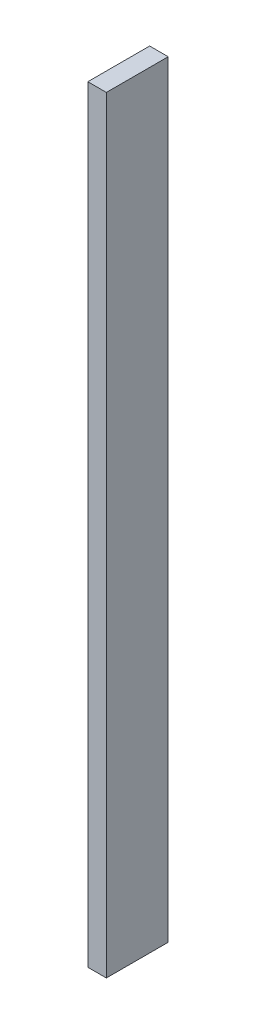
from build123d import *

# Parameters (mm, degrees)
SKETCH1_W           = 124
SKETCH1_H           = 3
BOSS_EXTRUDE1_DEPTH = 10


with BuildPart() as part:
    # Sketch1 → Boss-Extrude1 (new body)
    with BuildSketch(Plane(origin=(0, 0, 0), x_dir=(0, 1, 0), z_dir=(0, 0, 1))):
        Rectangle(SKETCH1_W, SKETCH1_H)
    extrude(amount=BOSS_EXTRUDE1_DEPTH)


solid = part.part
